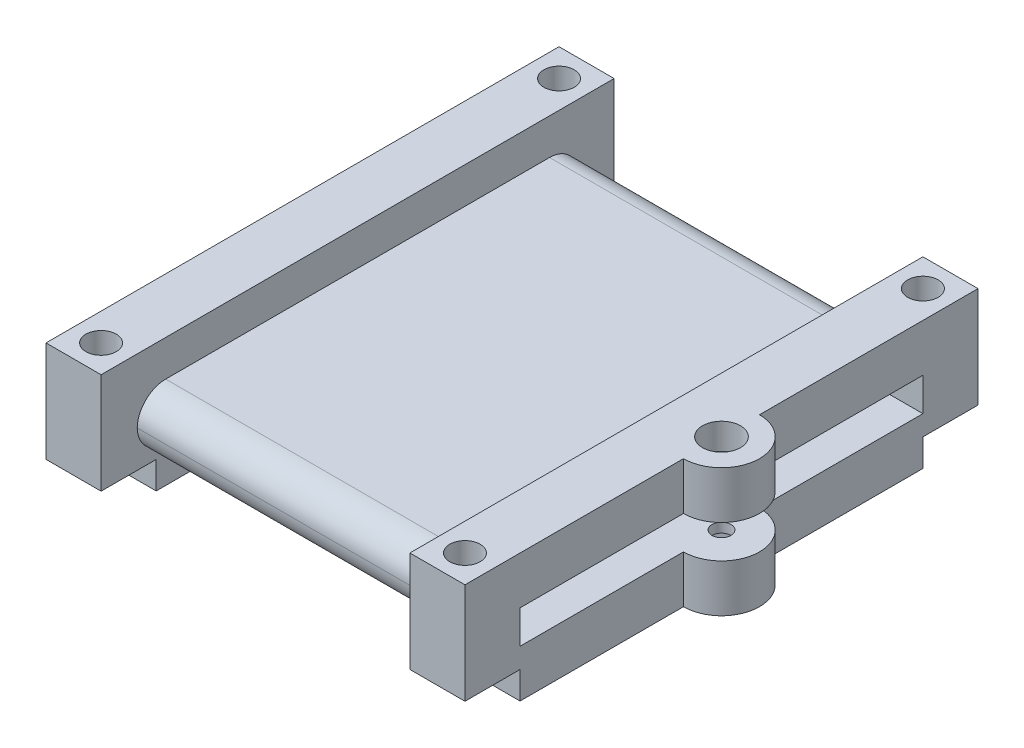
from build123d import *

# Parameters (mm, degrees)
SKETCH1_W           = 46.4
SKETCH1_H           = 5.9
SKETCH1_W_2         = 42.4
SKETCH1_H_2         = 3.5
BOSS_EXTRUDE1_DEPTH = 32.5
FILLET2_R           = 3
SKETCH2_W           = 54
SKETCH2_H           = 13.5
SKETCH2_W_2         = 42.4
SKETCH2_H_2         = 3.5
BOSS_EXTRUDE2_DEPTH = 5.8
SKETCH3_W           = 54
SKETCH3_H           = 13.5
SKETCH3_W_2         = 42.4
SKETCH3_H_2         = 3.5
BOSS_EXTRUDE3_DEPTH = 5.8
SKETCH4_R           = 1.6
CUT_EXTRUDE1_DEPTH  = 65.569187698
SKETCH8_R           = 4
BOSS_EXTRUDE4_DEPTH = 13.5
CUT_EXTRUDE4_DEPTH  = 4
SKETCH15_W          = 42.4
SKETCH15_H          = 3.5
SKETCH15_W_2        = 5.8
SKETCH15_H_2        = 2.88
CUT_EXTRUDE5_DEPTH  = 71.197863215
FILLET3_R           = 2


with BuildPart() as part:
    # Sketch1 → Boss-Extrude1 (new body)
    with BuildSketch(Plane(origin=(0, 0, 0), x_dir=(0, 0, -1), z_dir=(1, 0, 0))):
        with Locations((23.2, 2.95)):
            Rectangle(SKETCH1_W, SKETCH1_H)
        with Locations((23.2, 2.95)):
            Rectangle(SKETCH1_W_2, SKETCH1_H_2, mode=Mode.SUBTRACT)
    extrude(amount=BOSS_EXTRUDE1_DEPTH)

    # Fillet2
    # the kernel refuses this fillet: 3 mm, written as the material it takes off along each edge
    with BuildSketch(Plane(origin=(-7.5, 0, -46.4), x_dir=(0, 0, 1), z_dir=(1, 0, 0)), Plane(origin=(-7.5, 5.9, 0), x_dir=(0, 0, -1), z_dir=(1, 0, 0)), Plane(origin=(-7.5, 5.9, -46.4), x_dir=(0, -1, 0), z_dir=(1, 0, 0))) as fillet2_piece_1:
        with BuildLine():
            CenterArc((FILLET2_R, -FILLET2_R), FILLET2_R, 90, 90)
            Line((0, -FILLET2_R), (0, 0))
            Line((0, 0), (FILLET2_R, 0))
        make_face()
    extrude(amount=47.5, mode=Mode.SUBTRACT)
    with BuildSketch(Plane(origin=(-7.5, 0, 0), x_dir=(0, 0, -1), z_dir=(1, 0, 0))) as fillet2_piece_2:
        with BuildLine():
            CenterArc((FILLET2_R, FILLET2_R), FILLET2_R, 180, 90)
            Line((0, FILLET2_R), (0, 0))
            Line((0, 0), (FILLET2_R, 0))
        make_face()
    extrude(amount=47.5, mode=Mode.SUBTRACT)

    # Sketch2 → Boss-Extrude2 (add)
    with BuildSketch(Plane(origin=(32.5, 0, 0), x_dir=(0, 0, -1), z_dir=(1, 0, 0))):
        with Locations((23.2, 2.95)):
            Rectangle(SKETCH2_W, SKETCH2_H)
        with Locations((23.2, 2.95)):
            Rectangle(SKETCH2_W_2, SKETCH2_H_2, mode=Mode.SUBTRACT)
    extrude(amount=BOSS_EXTRUDE2_DEPTH)

    # Sketch3 → Boss-Extrude3 (add)
    with BuildSketch(Plane.ZY):
        with Locations((-23.2, 2.95)):
            Rectangle(SKETCH3_W, SKETCH3_H)
        with Locations((-23.2, 2.95)):
            Rectangle(SKETCH3_W_2, SKETCH3_H_2, mode=Mode.SUBTRACT)
    extrude(amount=BOSS_EXTRUDE3_DEPTH)

    # Sketch4 → Cut-Extrude1 (cut, through all)
    with BuildSketch(Plane(origin=(0, 9.7, 0), x_dir=(1, 0, 0), z_dir=(0, 1, 0))):
        with Locations(Location((-2.9, 47.3, 0), (0, 0, 270))):
            Circle(SKETCH4_R)
        with Locations(Location((35.4, 47.3, 0), (0, 0, 270))):
            Circle(SKETCH4_R)
        with Locations(Location((-2.9, -0.9, 0), (0, 0, 270))):
            Circle(SKETCH4_R)
        with Locations(Location((35.4, -0.9, 0), (0, 0, 270))):
            Circle(SKETCH4_R)
    extrude(amount=-CUT_EXTRUDE1_DEPTH, mode=Mode.SUBTRACT)

    # Sketch8 → Boss-Extrude4 (add)
    with BuildSketch(Plane(origin=(0, 9.7, 0), x_dir=(1, 0, 0), z_dir=(0, 1, 0))):
        with Locations(Location((38.3, 23.2, 0), (0, 0, 270))):
            Circle(SKETCH8_R)
    extrude(amount=-BOSS_EXTRUDE4_DEPTH)

    # Sketch13 → CSK for M2 Flat Head Machine Screw1 (revolve, cut)
    with BuildSketch(Plane(origin=(38.3, 9.7, -23.2), x_dir=(0, 0, 1), z_dir=(1, 0, 0))):
        Polygon((0, 0), (0, 13.5), (1, 13.5), (1, 3.75), (2, 2.75), (2, 0), align=None)
    revolve(axis=Axis((38.3, 16.05, -23.2), (0, -1, 0)), mode=Mode.SUBTRACT)

    # Sketch14 → Cut-Extrude4 (cut)
    with BuildSketch(Plane.XZ.offset(3.8)):
        Polygon((38.3, -20.775128869), (36.2, -21.987564435), (36.2, -24.412435565), (38.3, -25.624871131), (40.4, -24.412435565), (40.4, -21.987564435), align=None)
    extrude(amount=-CUT_EXTRUDE4_DEPTH, mode=Mode.SUBTRACT)

    # Sketch15 → Cut-Extrude5 (cut, through all)
    with BuildSketch(Plane.ZY.offset(5.8)):
        with Locations((-23.2, 2.95)):
            Rectangle(SKETCH15_W, SKETCH15_H)
        with Locations((-47.3, -2.36)):
            Rectangle(SKETCH15_W_2, SKETCH15_H_2)
        with Locations((0.9, -2.36)):
            Rectangle(SKETCH15_W_2, SKETCH15_H_2)
    extrude(amount=-CUT_EXTRUDE5_DEPTH, mode=Mode.SUBTRACT)

    # Fillet3
    fillet3_edges = [part.edges().sort_by_distance(p)[0] for p in [
        (-5.8, -3.8, -23.2),
    ]]
    fillet(fillet3_edges, radius=FILLET3_R)


solid = part.part
